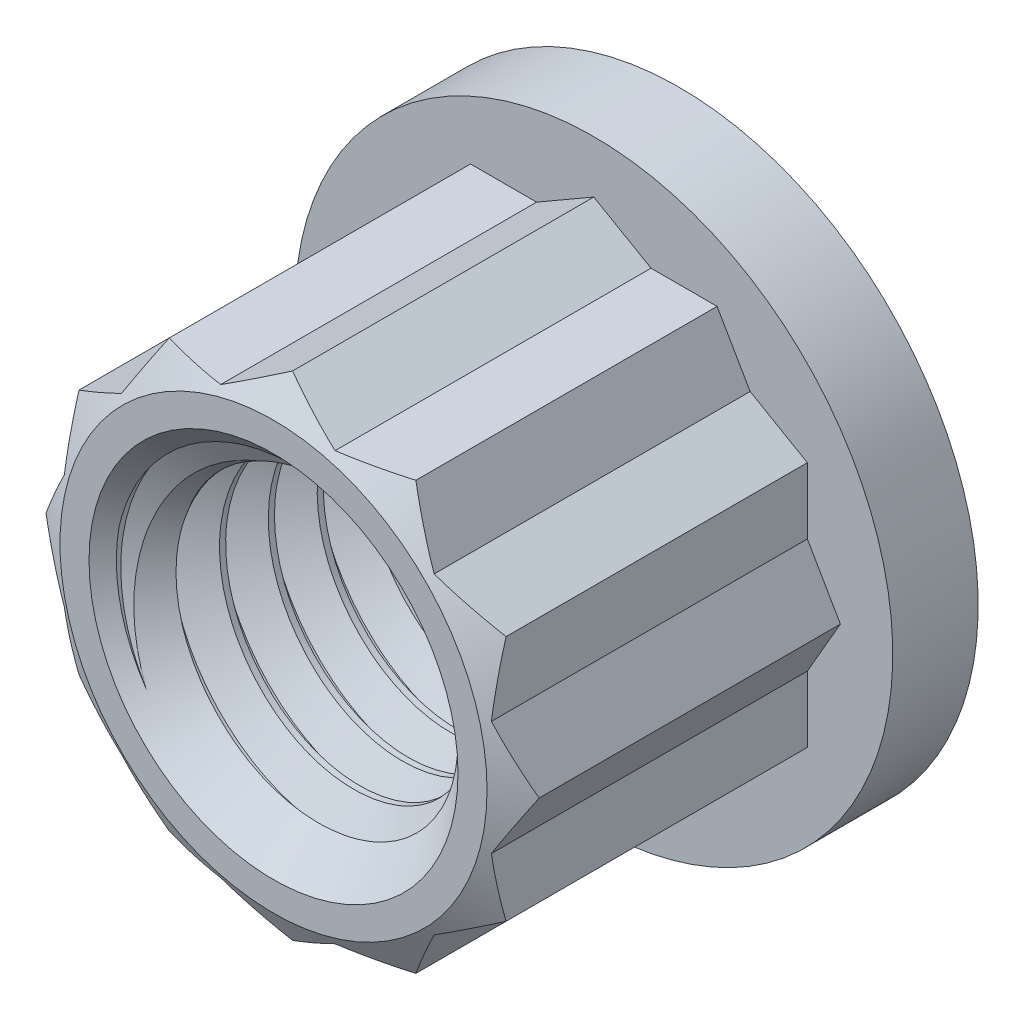
from build123d import *

# Parameters (mm, degrees)
EXTRUDE1_DEPTH     = 7.540625
EXTRUDE4_DEPTH     = 7.540625
SKETCH13_R         = 5.55625
EXTRUDE3_DEPTH     = 1.5875
SKETCH2_OUTSIDE_W  = 57.788
SKETCH2_OUTSIDE_H  = 57.788
SKETCH2_OUTSIDE_R  = 3.96875
CUT_EXTRUDE1_DEPTH = 11.890585545
CUT_EXTRUDE1_DRAFT = -60
SKETCH4_R          = 3.175
CUT_EXTRUDE3_DEPTH = 11.890585545
SKETCH12_R         = 3.175
SKETCH12_R_2       = 2.585793431
EXTRUDE2_DEPTH     = 7.540625
CUT_SWEEP1_PITCH   = 0.907142857


with BuildPart() as part:
    # Sketch1 → Extrude1 (new body)
    with BuildSketch(Plane.XY):
        Polygon((0, 4.582717762), (-3.96875, 2.291358881), (-3.96875, -2.291358881), (0, -4.582717762), (3.96875, -2.291358881), (3.96875, 2.291358881), align=None)
    extrude(amount=-EXTRUDE1_DEPTH)

    # Sketch14 → Extrude4 (add)
    with BuildSketch(Plane.XY):
        Polygon((-2.291358881, 3.96875), (-4.582717762, 0), (-2.291358881, -3.96875), (2.291358881, -3.96875), (4.582717762, 0), (2.291358881, 3.96875), align=None)
    extrude(amount=-EXTRUDE4_DEPTH)

    # Sketch13 → Extrude3 (add)
    with BuildSketch(Plane(origin=(0, 0, -7.540625), x_dir=(-1, 0, 0), z_dir=(0, 0, -1))):
        Circle(SKETCH13_R)
    extrude(amount=-EXTRUDE3_DEPTH)


with BuildPart() as cut_extrude1_tool:
    # Sketch2 outside → Cut-Extrude1 (with draft: the straight prism first)
    with BuildSketch(Plane.XY):
        Rectangle(SKETCH2_OUTSIDE_W, SKETCH2_OUTSIDE_H)
        Circle(SKETCH2_OUTSIDE_R, mode=Mode.SUBTRACT)
    extrude(amount=-CUT_EXTRUDE1_DEPTH)
    # Cut-Extrude1: the draft: its side faces are tilted about the plane it starts from
    cut_extrude1_sides = [cut_extrude1_tool.faces().sort_by_distance(p)[0] for p in [
        (0, -28.894, -5.945292773),
        (28.894, 0, -5.945292773),
        (0, 28.894, -5.945292773),
        (-28.894, 0, -5.945292773),
        (-3.96875, 0, -5.945292773),
    ]]
    draft(cut_extrude1_sides, Plane.XY, CUT_EXTRUDE1_DRAFT)


with BuildPart() as part_1:
    add(part.part)

    # Cut-Extrude1: cut by cut_extrude1_tool
    add(cut_extrude1_tool.part, mode=Mode.SUBTRACT)

    # Sketch4 → Cut-Extrude3 (cut, through all)
    with BuildSketch(Plane.XY):
        Circle(SKETCH4_R)
    extrude(amount=-CUT_EXTRUDE3_DEPTH, mode=Mode.SUBTRACT)

    # Sketch12 → Extrude2 (add)
    with BuildSketch(Plane.XY):
        Circle(SKETCH12_R)
        Circle(SKETCH12_R_2, mode=Mode.SUBTRACT)
    extrude(amount=-EXTRUDE2_DEPTH)

    # Cut-Sweep1: the profile of Sketch9 profile screwed along a right-hand helix of 9.3125 turns, 6 arcs to a turn; built about Z, then put on its axis
    cut_sweep1_z = Axis((0, 0, 0), (0, 0, 1))
    cut_sweep1_corners = [(3.175, 0, -0.453571429), (3.175, 0, -0.340178571), (2.585493431, 0, 0.000173205), (2.585493431, 0, -0.793923205)]
    with BuildLine(mode=Mode.PRIVATE) as cut_sweep1_profile:
        Line(cut_sweep1_corners[0], cut_sweep1_corners[1])
        Line(cut_sweep1_corners[1], cut_sweep1_corners[2])
        Line(cut_sweep1_corners[2], cut_sweep1_corners[3])
        Line(cut_sweep1_corners[3], cut_sweep1_corners[0])
    cut_sweep1_cap = Face(cut_sweep1_profile.wire())
    cut_sweep1_turn_angles = [0, 30, 60, 90, 120, 150, 180, 210, 240, 270, 300, 330, 360]
    cut_sweep1_turn_weights = [1, 0.8660254037844387, 1, 0.8660254037844387, 1, 0.8660254037844387, 1, 0.8660254037844387, 1, 0.8660254037844387, 1, 0.8660254037844387, 1]
    cut_sweep1_turn_rails = [Edge.make_bspline([Vector(p[0], p[1], 0).rotate(cut_sweep1_z, cut_sweep1_turn_angles[k]) / cut_sweep1_turn_weights[k] + Vector(0, 0, p[2] + CUT_SWEEP1_PITCH * cut_sweep1_turn_angles[k] / 360) for k in range(13)], [0, 0, 0, 1, 1, 2, 2, 3, 3, 4, 4, 5, 5, 6, 6, 6], 2, cut_sweep1_turn_weights) for p in cut_sweep1_corners]
    cut_sweep1_turn_sides = [Face.make_surface_from_curves(cut_sweep1_turn_rails[p[0]], cut_sweep1_turn_rails[p[1]]) for p in [(0, 1), (1, 2), (2, 3), (3, 0)]]
    cut_sweep1_last_angles = [3240, 3270, 3300, 3326.25, 3352.5]
    cut_sweep1_last_weights = [1, 0.8660254037844387, 1, 0.8968727415327269, 1]
    cut_sweep1_last_rails = [Edge.make_bspline([Vector(p[0], p[1], 0).rotate(cut_sweep1_z, cut_sweep1_last_angles[k]) / cut_sweep1_last_weights[k] + Vector(0, 0, p[2] + CUT_SWEEP1_PITCH * cut_sweep1_last_angles[k] / 360) for k in range(5)], [0, 0, 0, 1, 1, 2, 2, 2], 2, cut_sweep1_last_weights) for p in cut_sweep1_corners]
    cut_sweep1_last_sides = [Face.make_surface_from_curves(cut_sweep1_last_rails[p[0]], cut_sweep1_last_rails[p[1]]) for p in [(0, 1), (1, 2), (2, 3), (3, 0)]]
    cut_sweep1 = Plane(origin=(0, 0, 0), x_dir=(0, 1, 0), z_dir=(0, 0, -1)) * Solid(Shell([*[p.moved(Location((0, 0, CUT_SWEEP1_PITCH * i))) for i in range(9) for p in cut_sweep1_turn_sides], *cut_sweep1_last_sides, cut_sweep1_cap, cut_sweep1_cap.rotate(cut_sweep1_z, 3352.5).moved(Location((0, 0, CUT_SWEEP1_PITCH * 3352.5 / 360)))]))
    add(cut_sweep1, mode=Mode.SUBTRACT)

    # Cut-Extrude6 cone 1 section (through the dimple's axis) → Cut-Extrude6 (revolve, cut)
    with BuildSketch(Plane(origin=(0, 0, 0), x_dir=(0, -1, 0), z_dir=(1, 0, 0))):
        Polygon((0, 0), (3.429, 0), (0, 3.429), align=None)
    revolve(axis=Axis((0, 0, 0), (0, 0, -1)), mode=Mode.SUBTRACT)

    # Cut-Extrude7 cone 1 section (through the dimple's axis) → Cut-Extrude7 (revolve, cut)
    with BuildSketch(Plane(origin=(0, 0, -7.540625), x_dir=(0, 1, 0), z_dir=(1, 0, 0))):
        Polygon((0, 0), (3.429, 0), (0, 3.429), align=None)
    revolve(axis=Axis((0, 0, -7.540625), (0, 0, 1)), mode=Mode.SUBTRACT)


solid = part_1.part
